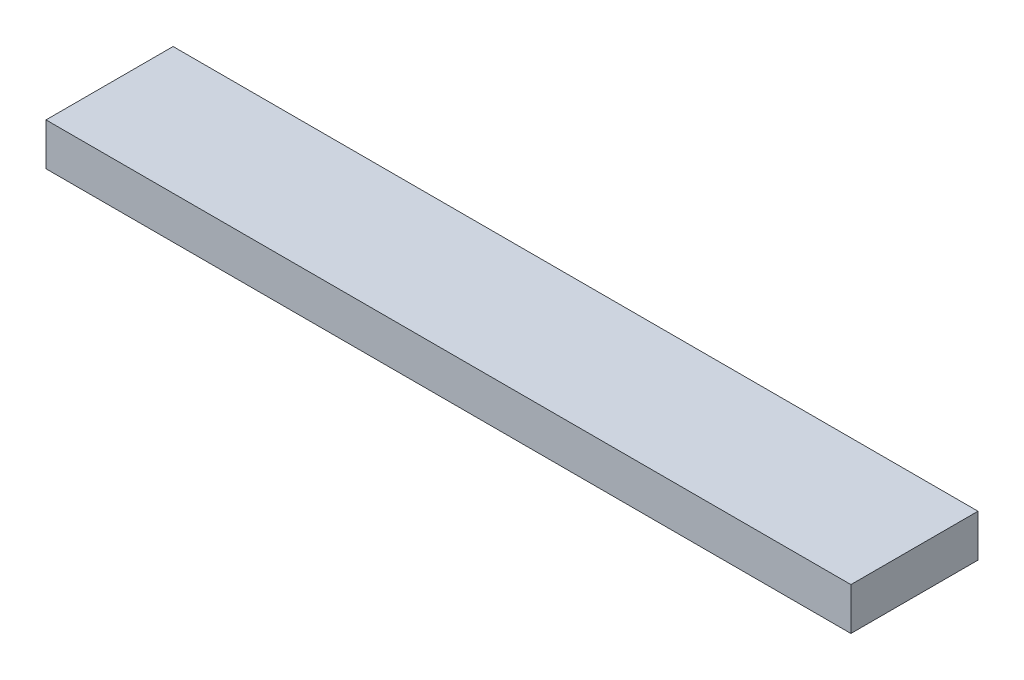
from build123d import *

# Parameters (mm, degrees)
SKIZZE1_W                       = 150
SKIZZE1_H                       = 50
AUFSATZ_LINEAR_AUSTRAGEN1_DEPTH = 950


with BuildPart() as part:
    # Skizze1 → Aufsatz-Linear austragen1 (new body)
    with BuildSketch(Plane(origin=(0, 0, 0), x_dir=(0, 0, -1), z_dir=(1, 0, 0))):
        with Locations((75, 25)):
            Rectangle(SKIZZE1_W, SKIZZE1_H)
    extrude(amount=AUFSATZ_LINEAR_AUSTRAGEN1_DEPTH)


solid = part.part
